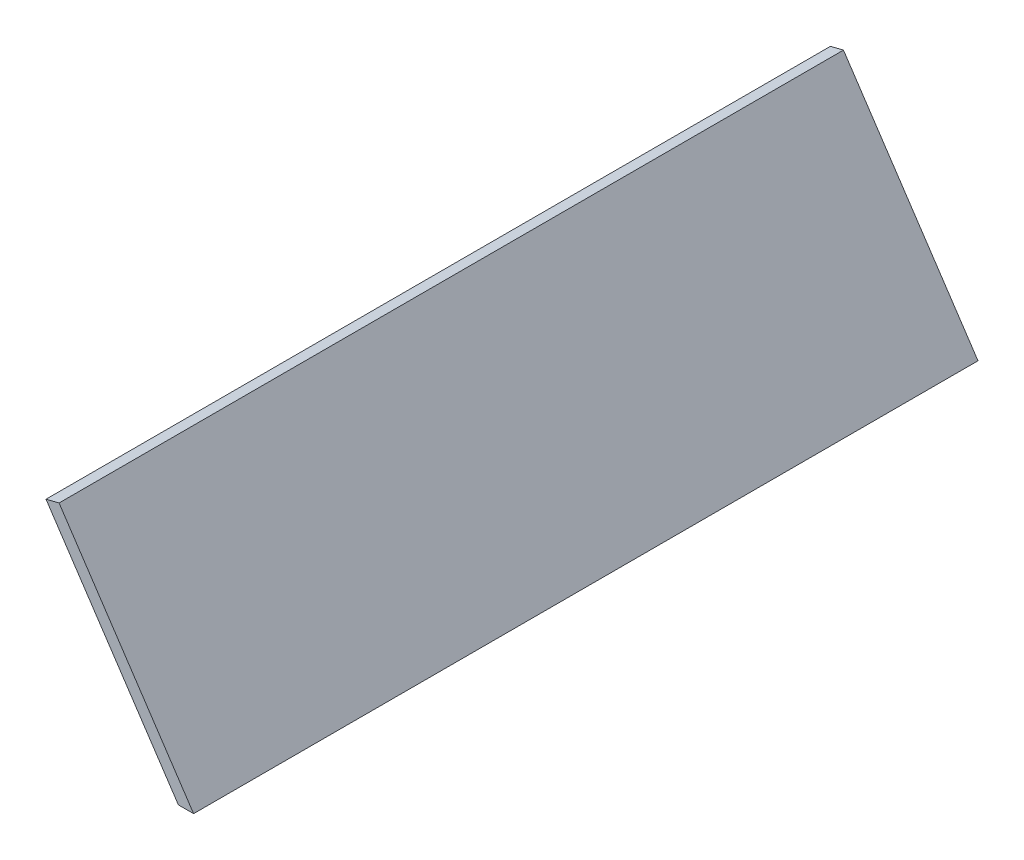
from build123d import *

# Parameters (mm, degrees)
BOSS_EXTRUDE1_DEPTH = 277.48


with BuildPart() as part:
    # Sketch1 → Boss-Extrude1 (new body)
    with BuildSketch(Plane.XY):
        Polygon((-194.892333822, -15.582627434), (-148.070819622, -85.815078074), (-142.680341115, -85.815078074), (-190.272105906, -14.427248598), align=None)
    extrude(amount=BOSS_EXTRUDE1_DEPTH)


solid = part.part
